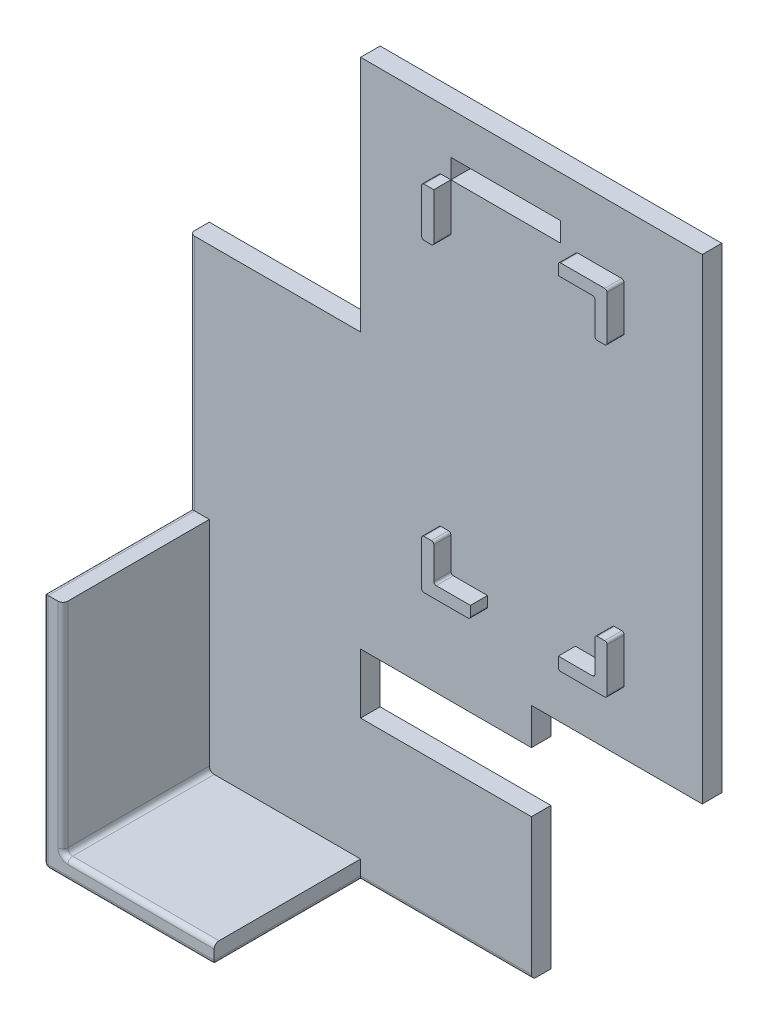
from build123d import *

# Parameters (mm, degrees)
EXTRUDE_1_DEPTH         = 8
CUT_EXTRUDE_1_DEPTH     = 2
SKETCH_3_R              = 2
CUT_EXTRUDE_2_DEPTH     = 5
SKETCH_4_W              = 62
SKETCH_4_H              = 8
EXTRUDE_2_DEPTH         = 60
FILLET_1_R              = 2
SKETCH_5_W              = 5
SKETCH_5_H              = 20
SKETCH_5_W_2            = 15
SKETCH_5_H_2            = 5
SKETCH_5_H_3            = 15
EXTRUDE_4_DEPTH         = 7
SKETCH_6_W              = 45
SKETCH_6_H              = 8
CUT_EXTRUDE_3_DEPTH     = 366.042805709
CUT_EXTRUDE_START       = -8
CUT_EXTRUDE_4_OUTLINE_W = 70
CUT_EXTRUDE_4_OUTLINE_H = 24.5
CUT_EXTRUDE_4_DEPTH     = 8
CUT_EXTRUDE_4_2_DEPTH   = 7
CUT_EXTRUDE_4_3_DEPTH   = 7


# Read off the part's stored shape, not the designer's step: 컷-돌출4
with BuildPart() as part:
    # 스케치1 → 보스-돌출1 (new body)
    with BuildSketch(Plane.XY):
        Polygon((0, 0), (140, 0), (140, 97.5), (210, 97.5), (210, 292.5), (70, 292.5), (70, 195), (0, 195), align=None)
    extrude(amount=EXTRUDE_1_DEPTH)

    # 스케치2 → 컷-돌출1 (cut)
    with BuildSketch(Plane.XY):
        Polygon((200.25, 287.531088913), (198.5, 284.5), (200.25, 281.468911087), (203.75, 281.468911087), (205.5, 284.5), (203.75, 287.531088913), align=None)
        Polygon((76.25, 287.531088913), (74.5, 284.5), (76.25, 281.468911087), (79.75, 281.468911087), (81.5, 284.5), (79.75, 287.531088913), align=None)
        Polygon((6.25, 189.986613874), (4.5, 186.955524961), (6.224322324, 183.968911087), (9.775677676, 183.968911087), (11.5, 186.955524961), (9.75, 189.986613874), align=None)
        Polygon((76.25, 217.531088913), (74.5, 214.5), (76.25, 211.468911087), (79.75, 211.468911087), (81.5, 214.5), (79.75, 217.531088913), align=None)
        Polygon((200.25, 140.531088913), (198.5, 137.5), (200.25, 134.468911087), (203.75, 134.468911087), (205.5, 137.5), (203.75, 140.531088913), align=None)
        Polygon((200.25, 108.531088913), (198.5, 105.5), (200.25, 102.468911087), (203.75, 102.468911087), (205.5, 105.5), (203.75, 108.531088913), align=None)
        Polygon((144.5, 105.5), (146.25, 102.468911087), (149.75, 102.468911087), (151.5, 105.5), (149.75, 108.531088913), (146.25, 108.531088913), align=None)
        Polygon((14.25, 102.531088913), (12.5, 99.5), (14.25, 96.468911087), (17.75, 96.468911087), (19.5, 99.5), (17.75, 102.531088913), align=None)
    extrude(amount=CUT_EXTRUDE_1_DEPTH, mode=Mode.SUBTRACT)

    # 스케치3 → 컷-돌출2 (cut)
    with BuildSketch(Plane(origin=(0, 0, 2), x_dir=(-1, 0, 0), z_dir=(0, 0, -1))):
        with Locations((-202.01036292, 284.501088913)):
            Circle(SKETCH_3_R)
        with Locations((-78.01036292, 284.501088913)):
            Circle(SKETCH_3_R)
        with Locations((-78.01036292, 214.498911087)):
            Circle(SKETCH_3_R)
        with Locations((-8.01036292, 186.998911087)):
            Circle(SKETCH_3_R)
        with Locations((-201.989637708, 137.501088913)):
            Circle(SKETCH_3_R)
        with Locations((-202.011036292, 105.501088913)):
            Circle(SKETCH_3_R)
        with Locations((-148.01036292, 105.501088913)):
            Circle(SKETCH_3_R)
        with Locations((-16.01036292, 99.528088913)):
            Circle(SKETCH_3_R)
    extrude(amount=-CUT_EXTRUDE_2_DEPTH, mode=Mode.SUBTRACT)

    # 스케치4 → 보스-돌출2 (add)
    with BuildSketch(Plane.XY.offset(8)):
        Polygon((0, 97.5), (0, 0), (8, 0), (8, 8), (8, 97.5), align=None)
        with Locations((39, 4)):
            Rectangle(SKETCH_4_W, SKETCH_4_H)
    extrude(amount=EXTRUDE_2_DEPTH)

    # 필렛1
    fillet_1_edges = [part.edges().sort_by_distance(p)[0] for p in [
        (0, 0, 34),
        (105, 0, 8),
        (70, 0, 38),
        (8, 8, 38),
        (0, 97.5, 38),
        (35, 0, 68),
        (39, 8, 68),
        (8, 52.75, 68),
        (0, 48.75, 68),
        (0, 146.25, 8),
    ]]
    fillet(fillet_1_edges, radius=FILLET_1_R)

    # 스케치5 → 보스-돌출4 (add)
    with BuildSketch(Plane.XY.offset(8)):
        with Locations((104.5, 257.5)):
            Rectangle(SKETCH_5_W, SKETCH_5_H)
        with Locations((165.5, 265)):
            Rectangle(SKETCH_5_W_2, SKETCH_5_H_2)
        Polygon((173, 267.5), (173, 262.5), (173, 247.5), (178, 247.5), (178, 267.5), align=None)
        Polygon((122, 127.5), (107, 127.5), (102, 127.5), (102, 122.5), (122, 122.5), align=None)
        with Locations((104.5, 135)):
            Rectangle(SKETCH_5_W, SKETCH_5_H_3)
        with Locations((165.5, 125)):
            Rectangle(SKETCH_5_W_2, SKETCH_5_H_2)
        Polygon((173, 142.5), (173, 127.5), (173, 122.5), (178, 122.5), (178, 142.5), align=None)
    extrude(amount=EXTRUDE_4_DEPTH)

    # 스케치6 → 컷-돌출3 (cut, through all)
    with BuildSketch(Plane.XY.offset(8)):
        with Locations((129.5, 271.5)):
            Rectangle(SKETCH_6_W, SKETCH_6_H)
    extrude(amount=-CUT_EXTRUDE_3_DEPTH, mode=Mode.SUBTRACT)

    # 컷-돌출4 outline → 컷-돌출4 (cut)
    with BuildSketch(Plane.XY.offset(8).offset(CUT_EXTRUDE_START)):
        with Locations((105, 70.25)):
            Rectangle(CUT_EXTRUDE_4_OUTLINE_W, CUT_EXTRUDE_4_OUTLINE_H)
    extrude(amount=CUT_EXTRUDE_4_DEPTH, mode=Mode.SUBTRACT)

    # Cut-Extrude 4 2 outline → Cut-Extrude 4 2 (cut)
    with BuildSketch(Plane.XY.offset(8)):
        with BuildLine():
            Line((173, 142.5), (173, 141.5))
            ThreePointArc((173, 141.5), (173.292893219, 142.207106781), (174, 142.5))
            Line((174, 142.5), (173, 142.5))
        make_face()
        with BuildLine():
            Line((178, 142.5), (177, 142.5))
            ThreePointArc((177, 142.5), (177.707106781, 142.207106781), (178, 141.5))
            Line((178, 141.5), (178, 142.5))
        make_face()
        with BuildLine():
            Line((178, 122.5), (178, 123.5))
            ThreePointArc((178, 123.5), (177.707106781, 122.792893219), (177, 122.5))
            Line((177, 122.5), (178, 122.5))
        make_face()
        with BuildLine():
            ThreePointArc((159, 122.5), (158.292893219, 122.792893219), (158, 123.5))
            Line((158, 123.5), (158, 122.5))
            Line((158, 122.5), (159, 122.5))
        make_face()
        with BuildLine():
            Line((107, 142.5), (106, 142.5))
            ThreePointArc((106, 142.5), (106.707106781, 142.207106781), (107, 141.5))
            Line((107, 141.5), (107, 142.5))
        make_face()
        with BuildLine():
            ThreePointArc((102, 141.5), (102.292893219, 142.207106781), (103, 142.5))
            Line((103, 142.5), (102, 142.5))
            Line((102, 142.5), (102, 141.5))
        make_face()
        with BuildLine():
            ThreePointArc((103, 122.5), (102.292893219, 122.792893219), (102, 123.5))
            Line((102, 123.5), (102, 122.5))
            Line((102, 122.5), (103, 122.5))
        make_face()
        with BuildLine():
            Line((122, 122.5), (122, 123.5))
            ThreePointArc((122, 123.5), (121.707106781, 122.792893219), (121, 122.5))
            Line((121, 122.5), (122, 122.5))
        make_face()
        with BuildLine():
            Line((107, 247.5), (107, 248.5))
            ThreePointArc((107, 248.5), (106.707106781, 247.792893219), (106, 247.5))
            Line((106, 247.5), (107, 247.5))
        make_face()
        with BuildLine():
            Line((102, 247.5), (103, 247.5))
            ThreePointArc((103, 247.5), (102.292893219, 247.792893219), (102, 248.5))
            Line((102, 248.5), (102, 247.5))
        make_face()
        with BuildLine():
            ThreePointArc((102, 266.5), (102.292893219, 267.207106781), (103, 267.5))
            Line((103, 267.5), (102, 267.5))
            Line((102, 267.5), (102, 266.5))
        make_face()
        with BuildLine():
            ThreePointArc((174, 247.5), (173.292893219, 247.792893219), (173, 248.5))
            Line((173, 248.5), (173, 247.5))
            Line((173, 247.5), (174, 247.5))
        make_face()
        with BuildLine():
            ThreePointArc((178, 248.5), (177.707106781, 247.792893219), (177, 247.5))
            Line((177, 247.5), (178, 247.5))
            Line((178, 247.5), (178, 248.5))
        make_face()
        with BuildLine():
            ThreePointArc((177, 267.5), (177.707106781, 267.207106781), (178, 266.5))
            Line((178, 266.5), (178, 267.5))
            Line((178, 267.5), (177, 267.5))
        make_face()
        with BuildLine():
            Line((158, 267.5), (158, 266.5))
            ThreePointArc((158, 266.5), (158.292893219, 267.207106781), (159, 267.5))
            Line((159, 267.5), (158, 267.5))
        make_face()
    extrude(amount=CUT_EXTRUDE_4_2_DEPTH, mode=Mode.SUBTRACT)

    # Cut-Extrude 4 3 outline → Cut-Extrude 4 3 (add)
    with BuildSketch(Plane.XY.offset(8)):
        with BuildLine():
            Line((173, 127.5), (173, 128.5))
            ThreePointArc((173, 128.5), (172.707106781, 127.792893219), (172, 127.5))
            Line((172, 127.5), (173, 127.5))
        make_face()
        with BuildLine():
            ThreePointArc((108, 127.5), (107.292893219, 127.792893219), (107, 128.5))
            Line((107, 128.5), (107, 127.5))
            Line((107, 127.5), (108, 127.5))
        make_face()
        with BuildLine():
            ThreePointArc((172, 262.5), (172.707106781, 262.207106781), (173, 261.5))
            Line((173, 261.5), (173, 262.5))
            Line((173, 262.5), (172, 262.5))
        make_face()
    extrude(amount=CUT_EXTRUDE_4_3_DEPTH)


solid = part.part
